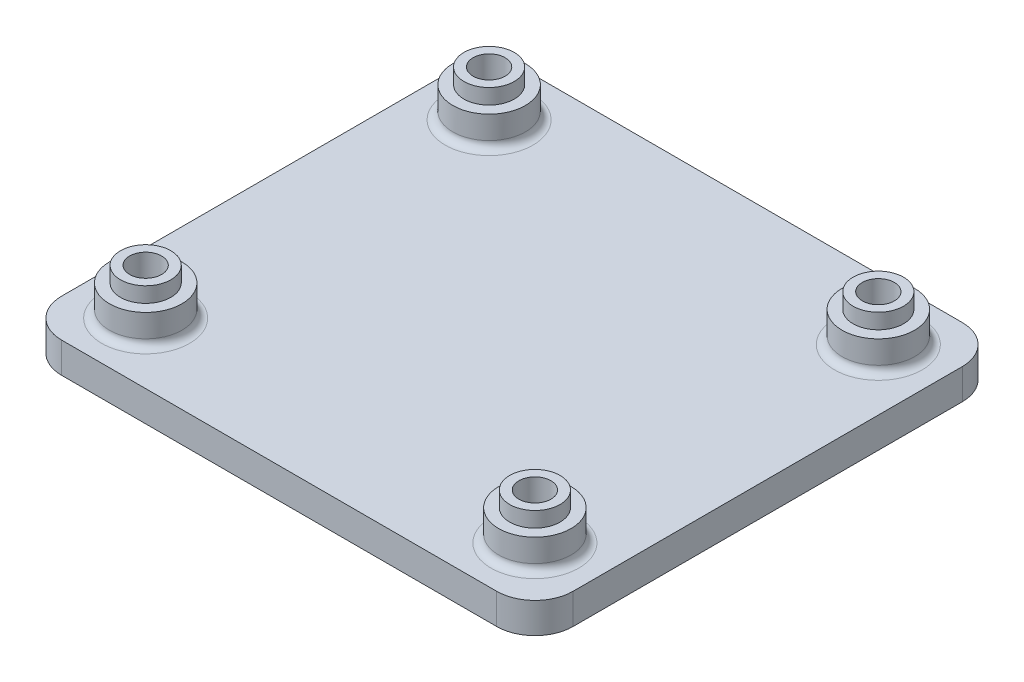
from build123d import *

# Parameters (mm, degrees)
ESQUISSE1_W             = 67
ESQUISSE1_H             = 61
BOSS_EXTRU_1_DEPTH      = 4
ESQUISSE4_R             = 4.75
BOSS_EXTRU_3_DEPTH      = 4
ESQUISSE5_R             = 3.3
BOSS_EXTRU_4_DEPTH      = 2
ESQUISSE6_R             = 2.1
ENL_V_MAT_EXTRU_2_DEPTH = 92.159201401
CONG_2_R                = 1
CONG_3_R                = 5


with BuildPart() as part:
    # Esquisse1 → Boss.-Extru.1 (new body)
    with BuildSketch(Plane(origin=(0, 0, 0), x_dir=(1, 0, 0), z_dir=(0, 1, 0))):
        with Locations((33.5, 30.5)):
            Rectangle(ESQUISSE1_W, ESQUISSE1_H)
    extrude(amount=BOSS_EXTRU_1_DEPTH)

    # Esquisse4 → Boss.-Extru.3 (add)
    with BuildSketch(Plane(origin=(0, 4, 0), x_dir=(1, 0, 0), z_dir=(0, 1, 0))):
        with Locations((8, 8)):
            Circle(ESQUISSE4_R)
        with Locations((8, 53)):
            Circle(ESQUISSE4_R)
        with Locations((59, 8)):
            Circle(ESQUISSE4_R)
        with Locations((59, 53)):
            Circle(ESQUISSE4_R)
    extrude(amount=BOSS_EXTRU_3_DEPTH)

    # Esquisse5 → Boss.-Extru.4 (add)
    with BuildSketch(Plane(origin=(0, 8, 0), x_dir=(1, 0, 0), z_dir=(0, 1, 0))):
        with Locations((59, 53)):
            Circle(ESQUISSE5_R)
        with Locations((59, 8)):
            Circle(ESQUISSE5_R)
        with Locations((8, 8)):
            Circle(ESQUISSE5_R)
        with Locations((8, 53)):
            Circle(ESQUISSE5_R)
    extrude(amount=BOSS_EXTRU_4_DEPTH)

    # Esquisse6 → Enlèv. mat.-Extru.2 (cut, through all)
    with BuildSketch(Plane(origin=(0, 10, 0), x_dir=(1, 0, 0), z_dir=(0, 1, 0))):
        with Locations((8, 8)):
            Circle(ESQUISSE6_R)
        with Locations((8, 53)):
            Circle(ESQUISSE6_R)
        with Locations((59, 53)):
            Circle(ESQUISSE6_R)
        with Locations((59, 8)):
            Circle(ESQUISSE6_R)
    extrude(amount=-ENL_V_MAT_EXTRU_2_DEPTH, mode=Mode.SUBTRACT)

    # Congé2
    cong_2_edges = [part.edges().sort_by_distance(p)[0] for p in [
        (54.25, 4, -53),
        (3.25, 4, -53),
        (3.25, 4, -8),
        (54.25, 4, -8),
    ]]
    fillet(cong_2_edges, radius=CONG_2_R)

    # Congé3
    cong_3_edges = [part.edges().sort_by_distance(p)[0] for p in [
        (0, 2, -61),
        (0, 2, 0),
        (67, 2, 0),
        (67, 2, -61),
    ]]
    fillet(cong_3_edges, radius=CONG_3_R)


solid = part.part
